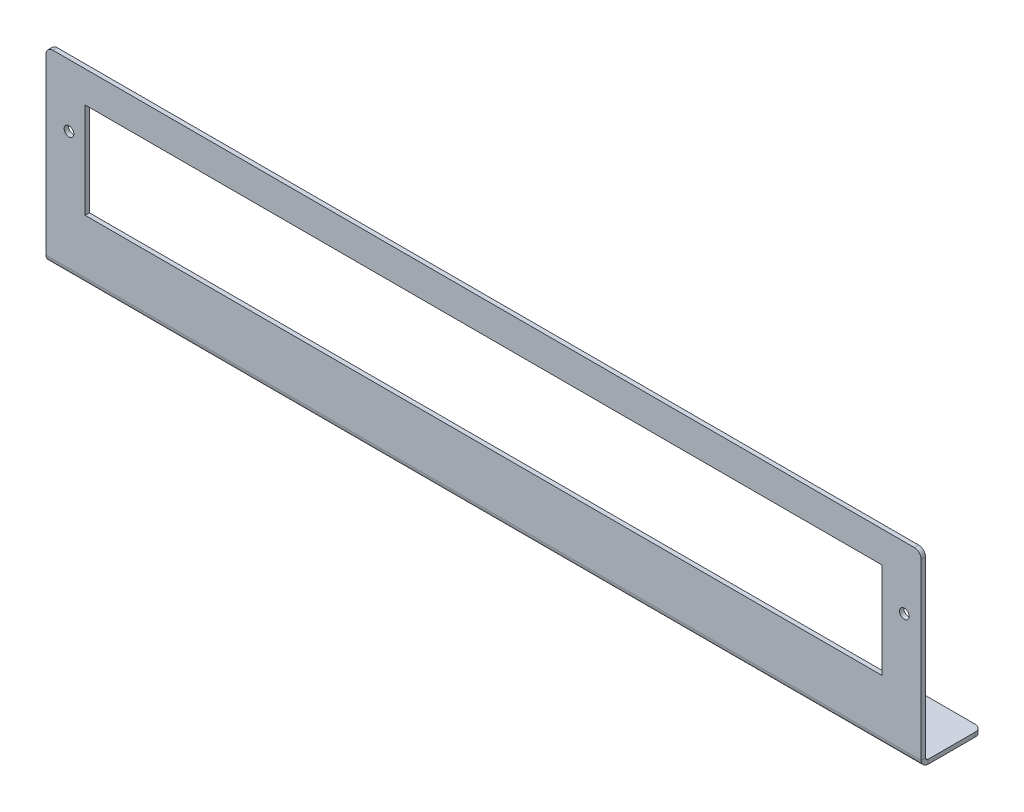
from build123d import *

# Parameters (mm, degrees)
SKETCH2_W                    = 255.76
SKETCH2_H                    = 54.86
SKETCH2_W_2                  = 232.9
SKETCH2_H_2                  = 27.94
BASE_FLANGE1_DEPTH           = 1.27
EDGE_FLANGE1_STRIP_W         = 6.5532
EDGE_FLANGE1_STRIP_H         = 1.27
EDGE_FLANGE1_STRIP_CUT_DEPTH = 255.76
EDGE_FLANGE1_DEPTH           = 255.76
F_34_0_111_DIAMETER_HOLE1_D  = 2.8194
FILLET1_R                    = 2


# Sheet-metal steps are written as plain solids
with BuildPart() as part:
    # Sketch2 → Base-Flange1 (new body)
    with BuildSketch(Plane.XY):
        Rectangle(SKETCH2_W, SKETCH2_H)
        with Locations((0, 4.32)):
            Rectangle(SKETCH2_W_2, SKETCH2_H_2, mode=Mode.SUBTRACT)
    extrude(amount=-BASE_FLANGE1_DEPTH)

    # Edge-Flange1 strip (across the edge) → Edge-Flange1 strip cut (cut)
    with BuildSketch(Plane(origin=(127.88, -27.43, -1.27), x_dir=(0, 1, 0), z_dir=(-1, 0, 0))):
        with Locations((-1.27, -0.635)):
            Rectangle(EDGE_FLANGE1_STRIP_W, EDGE_FLANGE1_STRIP_H)
    extrude(amount=EDGE_FLANGE1_STRIP_CUT_DEPTH, mode=Mode.SUBTRACT)

    # Edge-Flange1 section (across the edge) → Edge-Flange1 (add)
    with BuildSketch(Plane(origin=(127.88, -27.43, -1.27), x_dir=(0, 1, 0), z_dir=(-1, 0, 0))):
        with BuildLine():
            Line((0, 0.7366), (0, 16.51))
            Line((0, 16.51), (1.27, 16.51))
            Line((1.27, 16.51), (1.27, 0.7366))
            ThreePointArc((1.27, 0.7366), (1.485745145, 0.215745145), (2.0066, 0))
            Line((2.0066, 0), (2.0066, -1.27))
            ThreePointArc((2.0066, -1.27), (0.587719533, -0.682280467), (0, 0.7366))
        make_face()
    extrude(amount=EDGE_FLANGE1_DEPTH)

    # #34 (0.111) Diameter Hole1 (through all)
    with Locations(Plane(origin=(0, 0, -1.27), x_dir=(-1, 0, 0), z_dir=(0, 0, -1))):
        with Locations((-122.95, 9.24), (121.16, 9.24)):
            Hole(F_34_0_111_DIAMETER_HOLE1_D / 2)

    # Fillet1
    fillet1_edges = [part.edges().sort_by_distance(p)[0] for p in [
        (127.88, -26.795, -17.78),
        (-127.88, -26.795, -17.78),
        (-127.88, 27.43, -0.635),
        (127.88, 27.43, -0.635),
    ]]
    fillet(fillet1_edges, radius=FILLET1_R)


solid = part.part
